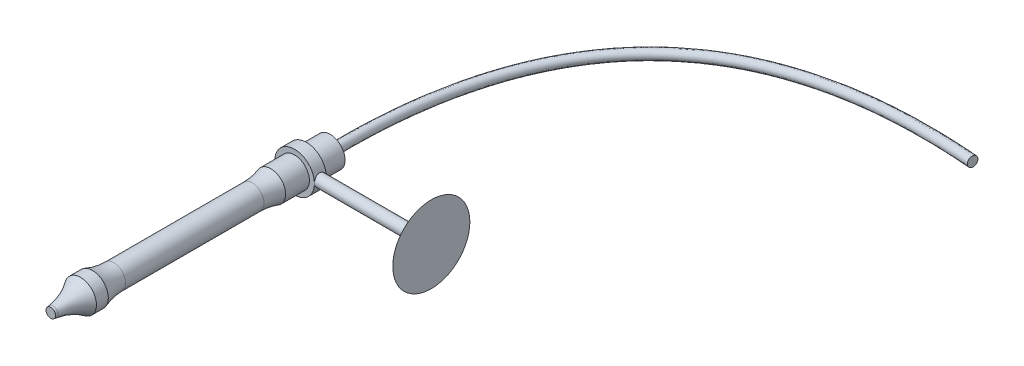
from build123d import *

# Parameters (mm, degrees)
SKETCH1_R           = 2.5
BOSS_EXTRUDE1_DEPTH = 10
SKETCH2_R           = 2
BOSS_EXTRUDE2_DEPTH = 30
SKETCH3_R           = 2.672684215
BOSS_EXTRUDE3_DEPTH = 2
SKETCH4_R           = 1.424041606
BOSS_EXTRUDE4_DEPTH = 5
BOSS_EXTRUDE4_TAPER = 7
FILLET1_R           = 10
FILLET2_R           = 10
SKETCH5_R           = 3.335459114
BOSS_EXTRUDE5_DEPTH = 1
SKETCH6_R           = 0.98763842
BOSS_EXTRUDE6_DEPTH = 20
SKETCH7_R           = 0.98763842
BOSS_EXTRUDE7_DEPTH = 2
BOSS_EXTRUDE7_DRAFT = -70
SKETCH8_R           = 0.823056941


with BuildPart() as part:
    # Sketch1 → Boss-Extrude1 (new body)
    with BuildSketch(Plane.XY):
        Circle(SKETCH1_R)
    extrude(amount=BOSS_EXTRUDE1_DEPTH)

    # Sketch2 → Boss-Extrude2 (add)
    with BuildSketch(Plane.XY.offset(10)):
        Circle(SKETCH2_R)
    extrude(amount=BOSS_EXTRUDE2_DEPTH)

    # Sketch3 → Boss-Extrude3 (add)
    with BuildSketch(Plane.XY.offset(40)):
        Circle(SKETCH3_R)
    extrude(amount=BOSS_EXTRUDE3_DEPTH)

    # Sketch4 → Boss-Extrude4 (add)
    with BuildSketch(Plane.XY.offset(42)):
        Circle(SKETCH4_R)
    extrude(amount=BOSS_EXTRUDE4_DEPTH, taper=BOSS_EXTRUDE4_TAPER)

    # Fillet1
    # the kernel refuses this fillet: 10 mm, written as the material it adds along each edge
    with BuildSketch(Plane(origin=(0, 0, 10), x_dir=(1, 0, 0), z_dir=(0, -1, 0))) as fillet1_piece_1:
        with BuildLine():
            CenterArc((12, 3.122498999), FILLET1_R, 180, 18.194872339)
            Line((2.5, 0), (2.31, -0.06244998))
            ThreePointArc((2.31, -0.06244998), (2.25, -0.2), (2, -0.2))
            Line((2, -0.2), (1.8, 0))
            Line((1.8, 0), (1.8, 3.122498999))
            Line((1.8, 3.122498999), (2, 3.122498999))
        make_face()
    revolve(axis=Axis((0, 0, 10), (0, 0, 1)))

    # Fillet2
    # the kernel refuses this fillet: 10 mm, written as the material it adds along each edge
    with BuildSketch(Plane(origin=(0, 0, 42), x_dir=(1, 0, 0), z_dir=(0, 1, 0))) as fillet2_piece_1:
        with BuildLine():
            CenterArc((10.780405886, -5.85361848), FILLET2_R, 144.171442973, 28.828557027)
            Line((0.85494437, -4.634925046), (0.656435139, -4.610551177))
            Line((0.656435139, -4.610551177), (1.225532376, 0.024373869))
            Line((1.225532376, 0.024373869), (1.424041606, 0.2))
            ThreePointArc((1.424041606, 0.2), (2.048362911, 0.2), (2.510529782, 0.11707237))
            Line((2.510529782, 0.11707237), (2.672684215, 0))
        make_face()
    revolve(axis=Axis((0, 0, 42), (0, 0, -1)))
    with BuildSketch(Plane(origin=(0, 0, 40), x_dir=(1, 0, 0), z_dir=(0, -1, 0))) as fillet2_piece_2:
        with BuildLine():
            CenterArc((12, -3.605714943), FILLET2_R, 158.864702411, 21.135297589)
            Line((2.672684215, 0), (2.4861379, 0.072114299))
            ThreePointArc((2.4861379, 0.072114299), (2.336342108, 0.2), (2, 0.2))
            Line((2, 0.2), (1.8, 0))
            Line((1.8, 0), (1.8, -3.605714943))
            Line((1.8, -3.605714943), (2, -3.605714943))
        make_face()
    revolve(axis=Axis((0, 0, 40), (0, 0, 1)))

    # Sketch5 → Boss-Extrude5 (add, symmetric)
    with BuildSketch(Plane(origin=(0, 0, 5), x_dir=(-1, 0, 0), z_dir=(0, 0, -1))):
        Circle(SKETCH5_R)
    extrude(amount=BOSS_EXTRUDE5_DEPTH, both=True)

    # Sketch6 → Boss-Extrude6 (add)
    with BuildSketch(Plane(origin=(0, 0, 0), x_dir=(0, 0, -1), z_dir=(1, 0, 0))):
        with Locations((-5, 0)):
            Circle(SKETCH6_R)
    extrude(amount=BOSS_EXTRUDE6_DEPTH)


with BuildPart() as boss_extrude7_tool:
    # Sketch7 → Boss-Extrude7 (with draft: the straight prism first)
    with BuildSketch(Plane(origin=(20, 0, 0), x_dir=(0, 0, -1), z_dir=(1, 0, 0))):
        with Locations((-5, 0)):
            Circle(SKETCH7_R)
    extrude(amount=BOSS_EXTRUDE7_DEPTH)
    # Boss-Extrude7: the draft: its side faces are tilted about the plane it starts from
    boss_extrude7_sides = [boss_extrude7_tool.faces().sort_by_distance(p)[0] for p in [
        (21, 0, 5.98763842),
    ]]
    draft(boss_extrude7_sides, Plane(origin=(20, 0, 0), x_dir=(0, 0, -1), z_dir=(1, 0, 0)), BOSS_EXTRUDE7_DRAFT)


with BuildPart() as part_1:
    add(part.part)

    # Boss-Extrude7: add boss_extrude7_tool
    add(boss_extrude7_tool.part)

    # Sweep2: sweep along a path in Sketch9
    with BuildLine() as sweep2_path:  # in the path sketch's own coordinates; laid on its plane below (add() does not lay a ready-made edge on the line's plane)
        add(Edge.make_bspline(
            [(0, 0), (-1.093369244, 57.22699907), (55.473126635, 52.578586404)],
            knots=[0, 0, 0, 1, 1, 1], degree=2))
    # Sketch8 → Sweep2 (sweep)
    with BuildSketch(Plane(origin=(0, 0, 0), x_dir=(-1, 0, 0), z_dir=(0, 0, -1))):
        Circle(SKETCH8_R)
    sweep(path=Plane(origin=(0, 0, 0), x_dir=(1, 0, 0), z_dir=(0, 1, 0)) * sweep2_path.line)


solid = part_1.part
